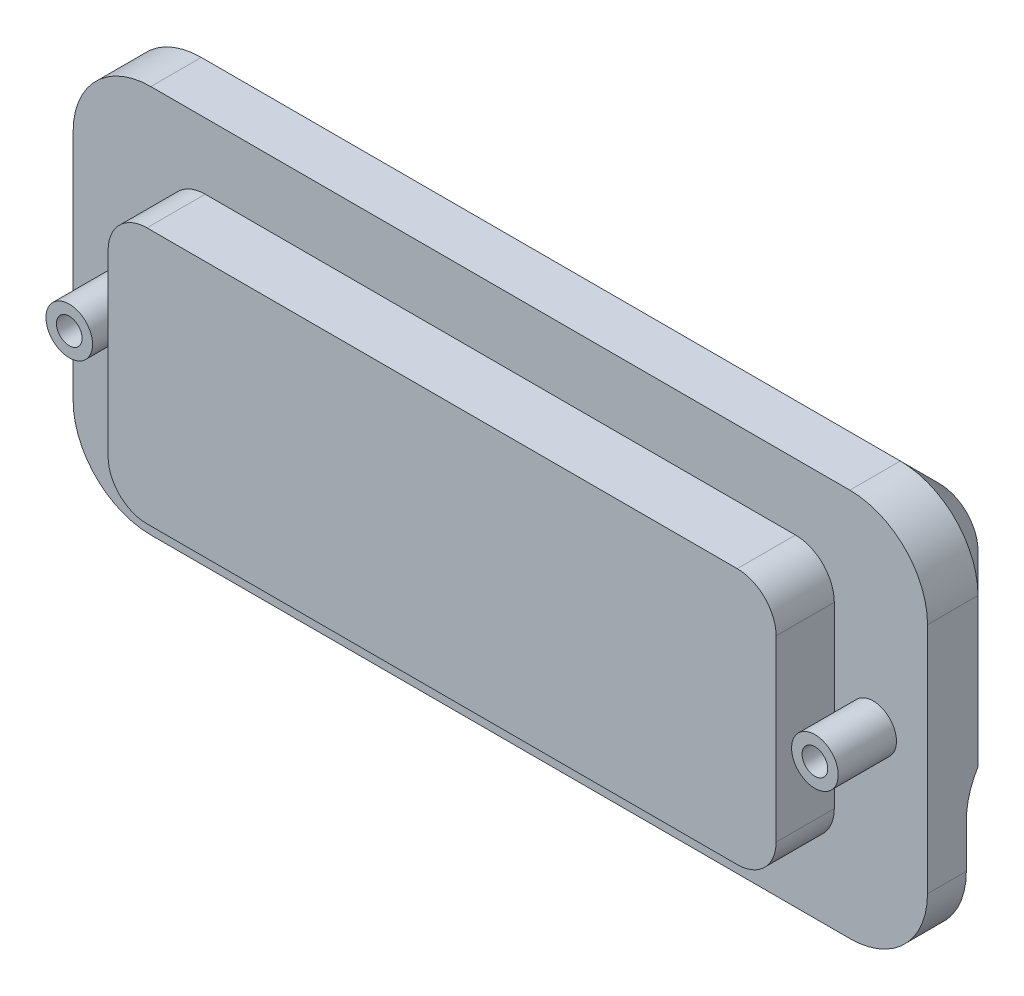
from build123d import *

# Parameters (mm, degrees)
SKETCH_1_W             = 110
SKETCH_1_H             = 50
EXTRUDE_1_DEPTH        = 5
SKETCH_2_R             = 3
EXTRUDE_2_DEPTH        = 7.5
HOLE_WIZARD_M4_1_D     = 3.3
HOLE_WIZARD_M4_1_DEPTH = 5
HOLE_WIZARD_M4_1_TIP   = 0.991420021
SKETCH_6_W             = 110
SKETCH_6_H             = 25
EXTRUDE_3_DEPTH        = 6.5
FILLET_1_R             = 10
CHAMFER_1_SIZE         = 5
FILLET_2_R             = 10


with BuildPart() as part:
    # 草图1 → 凸台-拉伸1 (new body)
    with BuildSketch(Plane.XY):
        Rectangle(SKETCH_1_W, SKETCH_1_H)
    extrude(amount=EXTRUDE_1_DEPTH)

    # 草图2 → 凸台-拉伸2 (add)
    with BuildSketch(Plane.XY.offset(5)):
        with Locations((-48, 0)):
            Circle(SKETCH_2_R)
        with Locations((48, 0)):
            Circle(SKETCH_2_R)
        with BuildLine():
            Line((-38, 16.5), (38, 16.5))
            ThreePointArc((38, 16.5), (41.535533906, 15.035533906), (43, 11.5))
            Line((43, 11.5), (43, -11.5))
            ThreePointArc((43, -11.5), (41.535533906, -15.035533906), (38, -16.5))
            Line((38, -16.5), (-38, -16.5))
            ThreePointArc((-38, -16.5), (-41.535533906, -15.035533906), (-43, -11.5))
            Line((-43, -11.5), (-43, 11.5))
            ThreePointArc((-43, 11.5), (-41.535533906, 15.035533906), (-38, 16.5))
        make_face()
    extrude(amount=EXTRUDE_2_DEPTH)

    # M4 螺纹孔1
    with Locations(Plane.XY.offset(12.5)):
        with Locations((48, 0), (-48, 0)):
            Hole(HOLE_WIZARD_M4_1_D / 2, depth=HOLE_WIZARD_M4_1_DEPTH)
            with Locations((0, 0, -(HOLE_WIZARD_M4_1_DEPTH + HOLE_WIZARD_M4_1_TIP / 2))):  # 118° drill point
                Cone(0, HOLE_WIZARD_M4_1_D / 2, HOLE_WIZARD_M4_1_TIP, mode=Mode.SUBTRACT)

    # 草图6 → 凸台-拉伸3 (add)
    with BuildSketch(Plane(origin=(0, 0, 0), x_dir=(-1, 0, 0), z_dir=(0, 0, -1))):
        with Locations((0, 12.5)):
            Rectangle(SKETCH_6_W, SKETCH_6_H)
    extrude(amount=EXTRUDE_3_DEPTH)

    # 圆角1
    fillet_1_edges = [part.edges().sort_by_distance(p)[0] for p in [
        (55, -25, 2.5),
        (-55, -25, 2.5),
        (-55, 25, -0.75),
        (55, 25, -0.75),
    ]]
    fillet(fillet_1_edges, radius=FILLET_1_R)

    # 倒角1
    chamfer_1_edges = [part.edges().sort_by_distance(p)[0] for p in [
        (-55, 7.5, -6.5),
        (0, 25, -6.5),
        (55, 7.5, -6.5),
        (-52.071067812, 22.071067812, -6.5),
        (52.071067812, 22.071067812, -6.5),
    ]]
    chamfer(chamfer_1_edges, length=CHAMFER_1_SIZE)

    # 圆角2
    # the kernel refuses this fillet: 10 mm, written as the material it adds along each edge
    with BuildSketch(Plane(origin=(55, 0, 0), x_dir=(0, 0, -1), z_dir=(-1, 0, 0))) as fillet_2_piece_1_section:
        with BuildLine():
            CenterArc((10, 9.367496998), FILLET_2_R, 180, 69.512684885)
            Line((0, 9.367496998), (-0.2, 9.367496998))
            Line((-0.2, 9.367496998), (-0.2, 0))
            Line((-0.2, 0), (0, -0.2))
            ThreePointArc((0, -0.2), (3.25, -0.2), (6.43, -0.18734994))
            Line((6.43, -0.18734994), (6.5, 0))
        make_face()
    fillet_2_piece_1 = extrude(amount=110, mode=Mode.PRIVATE)
    fillet_2_piece_1 = split(fillet_2_piece_1, bisect_by=Plane(origin=(-27.428646518, -2.275588703, -29.071353482), z_dir=(0.7071067811865476, 0, 0.7071067811865476)), keep=Keep.TOP, mode=Mode.PRIVATE)
    fillet_2_piece_1 = split(fillet_2_piece_1, bisect_by=Plane(origin=(27.428646518, -2.275588703, -29.071353482), z_dir=(-0.7071067811865476, 0, 0.7071067811865476)), keep=Keep.TOP, mode=Mode.PRIVATE)
    add(fillet_2_piece_1)


solid = part.part
